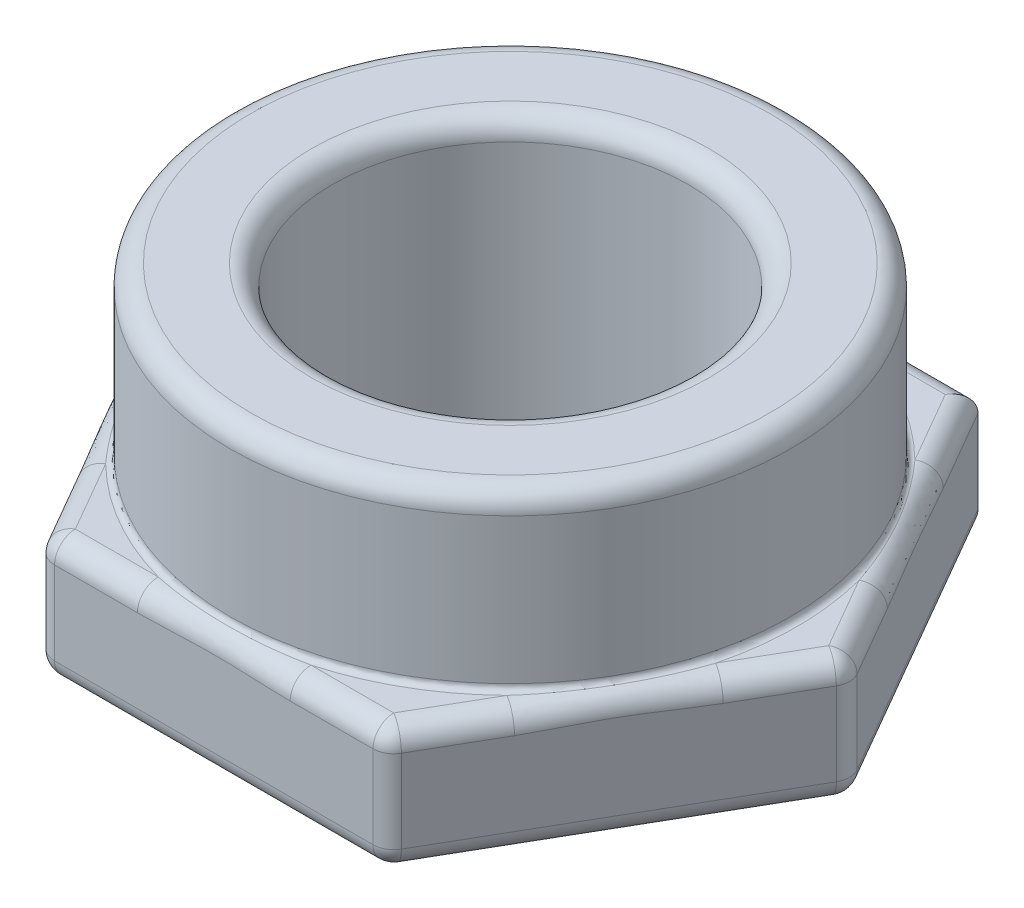
from build123d import *

# Parameters (mm, degrees)
BOSS_EXTRUDE1_DEPTH = 10.668
SKETCH2_R           = 24.003
BOSS_EXTRUDE2_DEPTH = 14.732
SKETCH3_R           = 15.24
CUT_EXTRUDE1_DEPTH  = 47.373843202
FILLET2_R           = 0.508
FILLET1_R           = 1.778


with BuildPart() as part:
    # Sketch1 → Boss-Extrude1 (new body)
    with BuildSketch(Plane(origin=(0, 0, 0), x_dir=(1, 0, 0), z_dir=(0, 1, 0))):
        Polygon((29.329393675, 0), (14.664696837, 25.4), (-14.664696837, 25.4), (-29.329393675, 0), (-14.664696837, -25.4), (14.664696837, -25.4), align=None)
    extrude(amount=BOSS_EXTRUDE1_DEPTH)

    # Sketch2 → Boss-Extrude2 (add)
    with BuildSketch(Plane(origin=(0, 10.668, 0), x_dir=(1, 0, 0), z_dir=(0, 1, 0))):
        Circle(SKETCH2_R)
    extrude(amount=BOSS_EXTRUDE2_DEPTH)

    # Sketch3 → Cut-Extrude1 (cut, through all)
    with BuildSketch(Plane(origin=(0, 25.4, 0), x_dir=(1, 0, 0), z_dir=(0, 1, 0))):
        Circle(SKETCH3_R)
    extrude(amount=-CUT_EXTRUDE1_DEPTH, mode=Mode.SUBTRACT)

    # Fillet2
    fillet2_edges = [part.edges().sort_by_distance(p)[0] for p in [
        (-24.003, 10.668, 0),
    ]]
    fillet(fillet2_edges, radius=FILLET2_R)

    # Fillet1
    fillet1_edges = [part.edges().sort_by_distance(p)[0] for p in [
        (-29.329393675, 5.334, 0),
        (-21.997045256, 10.668, 12.7),
        (-21.997045256, 0, 12.7),
        (-14.664696837, 5.334, 25.4),
        (0, 10.668, 25.4),
        (14.664696837, 5.334, 25.4),
        (0, 0, 25.4),
        (-15.24, 0, 0),
        (0, 0, -25.4),
        (-21.997045256, 0, -12.7),
        (-21.997045256, 10.668, -12.7),
        (-14.664696837, 5.334, -25.4),
        (0, 10.668, -25.4),
        (29.329393675, 5.334, 0),
        (21.997045256, 10.668, -12.7),
        (21.997045256, 0, -12.7),
        (21.997045256, 10.668, 12.7),
        (21.997045256, 0, 12.7),
        (-15.24, 25.4, 0),
        (-24.003, 25.4, 0),
    ]]
    fillet(fillet1_edges, radius=FILLET1_R)


solid = part.part
